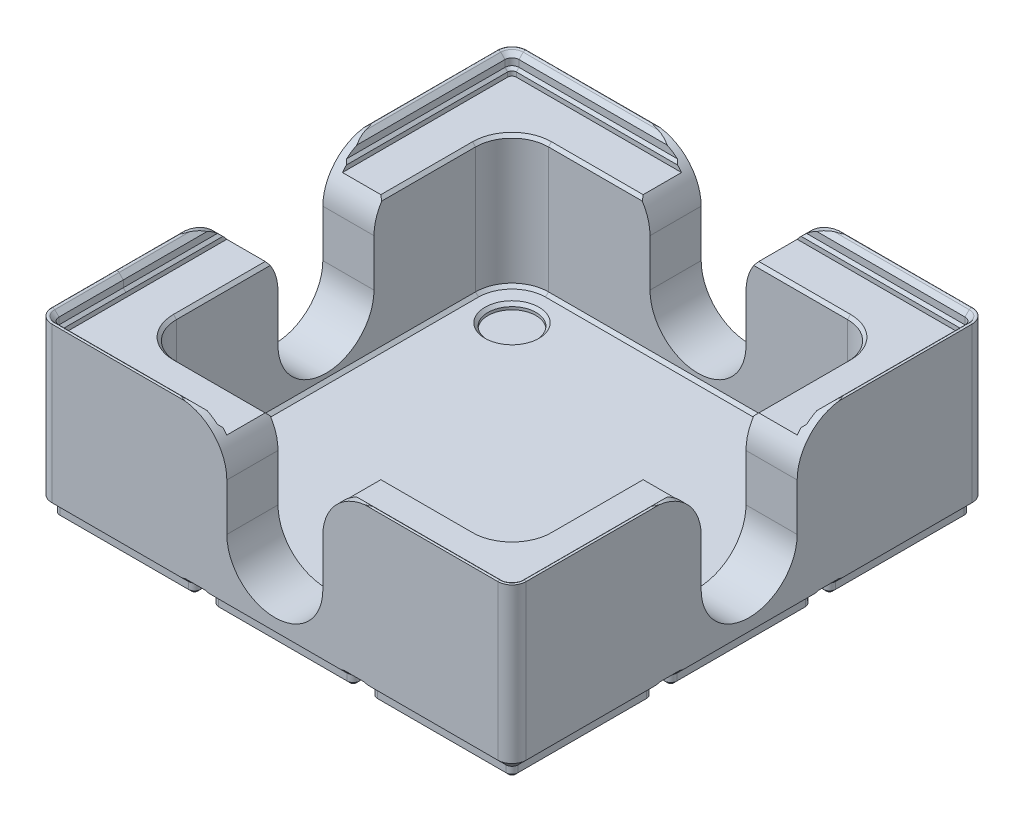
from build123d import *

# Parameters (mm, degrees)
BASE_DEPTH                          = 5
BOX_START                           = -126
BOX_OUTLINE_W                       = 126
BOX_OUTLINE_H                       = 37
BOX_DEPTH                           = 126
CORNER_FILLET_R                     = 4
BASE_CHAMFER_1_SIZE                 = 2.4
BASE_CHAMFER_2_SIZE                 = 0.8
BASE_PATTERN_COUNT                  = 3
BASE_PATTERN_PITCH                  = 42
BASE_PATTERN_COUNT_DIR2             = 3
BASE_PATTERN_PITCH_DIR2             = 42
BASE_CHAMFER_1_OF_BASE_PATTERN_SIZE = 2.4
BASE_CHAMFER_2_OF_BASE_PATTERN_SIZE = 0.8
MAGNET_START                        = -5
MAGNET_HOLE_OUTLINE_R               = 3.25
MAGNET_HOLE_DEPTH                   = 2
MAGNET_PATTERN_COUNT                = 3
MAGNET_PATTERN_PITCH                = 42
MAGNET_PATTERN_COUNT_DIR2           = 3
MAGNET_PATTERN_PITCH_DIR2           = 42
INTERIOR_CUT_DEPTH                  = 34.8
TOP_EDGE_FILLET_R                   = 0.6
NESTING_CLEARANCE_CUT_DEPTH         = 184.982198584
BOSS_EXTRUDE1_START                 = 33.6
BOSS_EXTRUDE1_DEPTH                 = 33.6
CUT_EXTRUDE1_DEPTH                  = 34.8
SKETCH18_R                          = 6.35
CUT_EXTRUDE2_DEPTH                  = 1.524
CUT_EXTRUDE3_REACH                  = 184.285
CIRPATTERN2_COUNT                   = 4
CHAMFER1_SIZE                       = 0.79375


# Read off the part's stored shape, not the designer's step: Box, Magnet Hole
with BuildPart() as part:
    # Master → Base (new body)
    with BuildSketch(Plane(origin=(0, 0, 0), x_dir=(1, 0, 0), z_dir=(0, 1, 0))):
        with BuildLine():
            Line((4, 2.4), (38, 2.4))
            ThreePointArc((38, 2.4), (39.13137085, 2.86862915), (39.6, 4))
            Line((39.6, 4), (39.6, 38))
            ThreePointArc((39.6, 38), (39.13137085, 39.13137085), (38, 39.6))
            Line((38, 39.6), (4, 39.6))
            ThreePointArc((4, 39.6), (2.86862915, 39.13137085), (2.4, 38))
            Line((2.4, 38), (2.4, 4))
            ThreePointArc((2.4, 4), (2.86862915, 2.86862915), (4, 2.4))
        make_face()
    base = extrude(amount=-BASE_DEPTH)

    # Box outline → Box (add)
    with BuildSketch(Plane.XY.offset(BOX_START)):
        with Locations((63, 18.5)):
            Rectangle(BOX_OUTLINE_W, BOX_OUTLINE_H)
    extrude(amount=BOX_DEPTH)

    # Corner Fillet
    corner_fillet_edges = [part.edges().sort_by_distance(p)[0] for p in [
        (0, 18.5, 0),
        (126, 18.5, 0),
        (126, 18.5, -126),
        (0, 18.5, -126),
    ]]
    fillet(corner_fillet_edges, radius=CORNER_FILLET_R)

    # Base Chamfer 1
    base_chamfer_1_edges = [part.edges().sort_by_distance(p)[0] for p in [
        (21, 0, -39.6),
        (2.86862915, 0, -39.13137085),
        (2.4, 0, -21),
        (2.86862915, 0, -2.86862915),
        (21, 0, -2.4),
        (39.13137085, 0, -2.86862915),
        (39.6, 0, -21),
        (39.13137085, 0, -39.13137085),
    ]]
    chamfer(base_chamfer_1_edges, length=BASE_CHAMFER_1_SIZE - 0.0001)  # a hair under: the kernel refuses the full size

    # Base Chamfer 2
    base_chamfer_2_edges = [part.edges().sort_by_distance(p)[0] for p in [
        (2.86862915, -5, -39.13137085),
        (21, -5, -39.6),
        (39.13137085, -5, -39.13137085),
        (39.6, -5, -21),
        (39.13137085, -5, -2.86862915),
        (21, -5, -2.4),
        (2.86862915, -5, -2.86862915),
        (2.4, -5, -21),
    ]]
    chamfer(base_chamfer_2_edges, length=BASE_CHAMFER_2_SIZE)

    # Base Pattern: Base 3 × 3
    with Locations(*[(j * BASE_PATTERN_PITCH_DIR2, 0, -i * BASE_PATTERN_PITCH) for i in range(BASE_PATTERN_COUNT) for j in range(BASE_PATTERN_COUNT_DIR2) if (i, j) != (0, 0)]):
        add(base)

    # Base Chamfer 1 of Base Pattern
    base_chamfer_1_of_base_pattern_edges = [part.edges().sort_by_distance(p)[0] for p in [
        (63, 0, -39.6),
        (44.86862915, 0, -39.13137085),
        (44.4, 0, -21),
        (44.86862915, 0, -2.86862915),
        (63, 0, -2.4),
        (81.13137085, 0, -2.86862915),
        (81.6, 0, -21),
        (81.13137085, 0, -39.13137085),
        (105, 0, -39.6),
        (86.86862915, 0, -39.13137085),
        (86.4, 0, -21),
        (86.86862915, 0, -2.86862915),
        (105, 0, -2.4),
        (123.13137085, 0, -2.86862915),
        (123.6, 0, -21),
        (123.13137085, 0, -39.13137085),
        (21, 0, -81.6),
        (2.86862915, 0, -81.13137085),
        (2.4, 0, -63),
        (2.86862915, 0, -44.86862915),
        (21, 0, -44.4),
        (39.13137085, 0, -44.86862915),
        (39.6, 0, -63),
        (39.13137085, 0, -81.13137085),
        (63, 0, -81.6),
        (44.86862915, 0, -81.13137085),
        (44.4, 0, -63),
        (44.86862915, 0, -44.86862915),
        (63, 0, -44.4),
        (81.13137085, 0, -44.86862915),
        (81.6, 0, -63),
        (81.13137085, 0, -81.13137085),
        (105, 0, -81.6),
        (86.86862915, 0, -81.13137085),
        (86.4, 0, -63),
        (86.86862915, 0, -44.86862915),
        (105, 0, -44.4),
        (123.13137085, 0, -44.86862915),
        (123.6, 0, -63),
        (123.13137085, 0, -81.13137085),
        (21, 0, -123.6),
        (2.86862915, 0, -123.13137085),
        (2.4, 0, -105),
        (2.86862915, 0, -86.86862915),
        (21, 0, -86.4),
        (39.13137085, 0, -86.86862915),
        (39.6, 0, -105),
        (39.13137085, 0, -123.13137085),
        (63, 0, -123.6),
        (44.86862915, 0, -123.13137085),
        (44.4, 0, -105),
        (44.86862915, 0, -86.86862915),
        (63, 0, -86.4),
        (81.13137085, 0, -86.86862915),
        (81.6, 0, -105),
        (81.13137085, 0, -123.13137085),
        (105, 0, -123.6),
        (86.86862915, 0, -123.13137085),
        (86.4, 0, -105),
        (86.86862915, 0, -86.86862915),
        (105, 0, -86.4),
        (123.13137085, 0, -86.86862915),
        (123.6, 0, -105),
        (123.13137085, 0, -123.13137085),
    ]]
    chamfer(base_chamfer_1_of_base_pattern_edges, length=BASE_CHAMFER_1_OF_BASE_PATTERN_SIZE - 0.0001)  # a hair under: the kernel refuses the full size

    # Base Chamfer 2 of Base Pattern
    base_chamfer_2_of_base_pattern_edges = [part.edges().sort_by_distance(p)[0] for p in [
        (44.86862915, -5, -39.13137085),
        (63, -5, -39.6),
        (81.13137085, -5, -39.13137085),
        (81.6, -5, -21),
        (81.13137085, -5, -2.86862915),
        (63, -5, -2.4),
        (44.86862915, -5, -2.86862915),
        (44.4, -5, -21),
        (86.86862915, -5, -39.13137085),
        (105, -5, -39.6),
        (123.13137085, -5, -39.13137085),
        (123.6, -5, -21),
        (123.13137085, -5, -2.86862915),
        (105, -5, -2.4),
        (86.86862915, -5, -2.86862915),
        (86.4, -5, -21),
        (2.86862915, -5, -81.13137085),
        (21, -5, -81.6),
        (39.13137085, -5, -81.13137085),
        (39.6, -5, -63),
        (39.13137085, -5, -44.86862915),
        (21, -5, -44.4),
        (2.86862915, -5, -44.86862915),
        (2.4, -5, -63),
        (44.86862915, -5, -81.13137085),
        (63, -5, -81.6),
        (81.13137085, -5, -81.13137085),
        (81.6, -5, -63),
        (81.13137085, -5, -44.86862915),
        (63, -5, -44.4),
        (44.86862915, -5, -44.86862915),
        (44.4, -5, -63),
        (86.86862915, -5, -81.13137085),
        (105, -5, -81.6),
        (123.13137085, -5, -81.13137085),
        (123.6, -5, -63),
        (123.13137085, -5, -44.86862915),
        (105, -5, -44.4),
        (86.86862915, -5, -44.86862915),
        (86.4, -5, -63),
        (2.86862915, -5, -123.13137085),
        (21, -5, -123.6),
        (39.13137085, -5, -123.13137085),
        (39.6, -5, -105),
        (39.13137085, -5, -86.86862915),
        (21, -5, -86.4),
        (2.86862915, -5, -86.86862915),
        (2.4, -5, -105),
        (44.86862915, -5, -123.13137085),
        (63, -5, -123.6),
        (81.13137085, -5, -123.13137085),
        (81.6, -5, -105),
        (81.13137085, -5, -86.86862915),
        (63, -5, -86.4),
        (44.86862915, -5, -86.86862915),
        (44.4, -5, -105),
        (86.86862915, -5, -123.13137085),
        (105, -5, -123.6),
        (123.13137085, -5, -123.13137085),
        (123.6, -5, -105),
        (123.13137085, -5, -86.86862915),
        (105, -5, -86.4),
        (86.86862915, -5, -86.86862915),
        (86.4, -5, -105),
    ]]
    chamfer(base_chamfer_2_of_base_pattern_edges, length=BASE_CHAMFER_2_OF_BASE_PATTERN_SIZE)

    # Magnet Hole outline → Magnet Hole (cut)
    with BuildSketch(Plane(origin=(0, 0, 0), x_dir=(1, 0, 0), z_dir=(0, 1, 0)).offset(MAGNET_START)):
        with Locations((8, 8)):
            Circle(MAGNET_HOLE_OUTLINE_R)
        with Locations((34, 8)):
            Circle(MAGNET_HOLE_OUTLINE_R)
        with Locations((34, 34)):
            Circle(MAGNET_HOLE_OUTLINE_R)
        with Locations((8, 34)):
            Circle(MAGNET_HOLE_OUTLINE_R)
    magnet_hole = extrude(amount=MAGNET_HOLE_DEPTH, mode=Mode.SUBTRACT)

    # Magnet Pattern: Magnet Hole 3 × 3
    with Locations(*[(i * MAGNET_PATTERN_PITCH, 0, -j * MAGNET_PATTERN_PITCH_DIR2) for i in range(MAGNET_PATTERN_COUNT) for j in range(MAGNET_PATTERN_COUNT_DIR2) if (i, j) != (0, 0)]):
        add(magnet_hole, mode=Mode.SUBTRACT)

    # Top Nesting Feature: sweep along a path in Sketch5
    with BuildLine(Plane(origin=(0, 37, 0), x_dir=(1, 0, 0), z_dir=(0, 1, 0))) as top_nesting_feature_path:
        Line((4, 0), (122, 0))
        ThreePointArc((122, 0), (124.828427125, 1.171572875), (126, 4))
        Line((126, 4), (126, 122))
        ThreePointArc((126, 122), (124.828427125, 124.828427125), (122, 126))
        Line((122, 126), (4, 126))
        ThreePointArc((4, 126), (1.171572875, 124.828427125), (0, 122))
        Line((0, 122), (0, 4))
        ThreePointArc((0, 4), (1.171572875, 1.171572875), (4, 0))
    # Sketch4 → Top Nesting Feature (sweep)
    with BuildSketch(Plane(origin=(0, 0, -21), x_dir=(-1, 0, 0), z_dir=(0, 0, -1))):
        Polygon((0, 37), (0, 41.646446609), (-2.15, 39.496446609), (-2.15, 37.696446609), (-2.846446609, 37), align=None)
    sweep(path=top_nesting_feature_path.line)

    # Sketch6 → Interior Cut (cut)
    with BuildSketch(Plane(origin=(0, 37, 0), x_dir=(1, 0, 0), z_dir=(0, 1, 0))):
        with BuildLine():
            Line((2.846446609, 122), (2.846446609, 21))
            Line((2.846446609, 21), (2.846446609, 4))
            ThreePointArc((2.846446609, 4), (3.184314575, 3.184314575), (4, 2.846446609))
            Line((4, 2.846446609), (122, 2.846446609))
            ThreePointArc((122, 2.846446609), (122.815685425, 3.184314575), (123.153553391, 4))
            Line((123.153553391, 4), (123.153553391, 122))
            ThreePointArc((123.153553391, 122), (122.815685425, 122.815685425), (122, 123.153553391))
            Line((122, 123.153553391), (4, 123.153553391))
            ThreePointArc((4, 123.153553391), (3.184314575, 122.815685425), (2.846446609, 122))
        make_face()
    extrude(amount=-INTERIOR_CUT_DEPTH, mode=Mode.SUBTRACT)

    # Interior Sweep: sweep along a path in Sketch7
    with BuildLine(Plane(origin=(0, 2.2, 0), x_dir=(1, 0, 0), z_dir=(0, 1, 0))) as interior_sweep_path:
        Line((4, 1.2), (122, 1.2))
        ThreePointArc((122, 1.2), (123.979898987, 2.020101013), (124.8, 4))
        Line((124.8, 4), (124.8, 122))
        ThreePointArc((124.8, 122), (123.979898987, 123.979898987), (122, 124.8))
        Line((122, 124.8), (4, 124.8))
        ThreePointArc((4, 124.8), (2.020101013, 123.979898987), (1.2, 122))
        Line((1.2, 122), (1.2, 4))
        ThreePointArc((1.2, 4), (2.020101013, 2.020101013), (4, 1.2))
    # Sketch8 → Interior Sweep (sweep, cut)
    with BuildSketch(Plane(origin=(0, 0, -21), x_dir=(-1, 0, 0), z_dir=(0, 0, -1))):
        Polygon((-2.846446609, 35.8), (-1.45, 34.403553391), (-1.45, 2.2), (-2.846446609, 2.2), align=None)
    sweep(path=interior_sweep_path.line, mode=Mode.SUBTRACT)

    # Top Edge Fillet
    top_edge_fillet_edges = [part.edges().sort_by_distance(p)[0] for p in [
        (0, 41.646446609, -63),
        (1.171572875, 41.646446609, -1.171572875),
        (63, 41.646446609, 0),
        (124.828427125, 41.646446609, -1.171572875),
        (126, 41.646446609, -63),
        (124.828427125, 41.646446609, -124.828427125),
        (63, 41.646446609, -126),
        (1.171572875, 41.646446609, -124.828427125),
        (0, 41.646446609, -63),
    ]]
    fillet(top_edge_fillet_edges, radius=TOP_EDGE_FILLET_R)

    # Sketch14 → Nesting Clearance Cut (cut, through all)
    with BuildSketch(Plane.XZ.offset(5)):
        with BuildLine():
            Line((-1, -4), (-1, -122))
            ThreePointArc((-1, -122), (0.464466094, -125.535533906), (4, -127))
            Line((4, -127), (122, -127))
            ThreePointArc((122, -127), (125.535533906, -125.535533906), (127, -122))
            Line((127, -122), (127, -4))
            ThreePointArc((127, -4), (125.535533906, -0.464466094), (122, 1))
            Line((122, 1), (4, 1))
            ThreePointArc((4, 1), (0.464466094, -0.464466094), (-1, -4))
        make_face()
        with BuildLine():
            Line((0.25, -4), (0.25, -122))
            ThreePointArc((0.25, -122), (1.348349571, -124.651650429), (4, -125.75))
            Line((4, -125.75), (122, -125.75))
            ThreePointArc((122, -125.75), (124.651650429, -124.651650429), (125.75, -122))
            Line((125.75, -122), (125.75, -4))
            ThreePointArc((125.75, -4), (124.651650429, -1.348349571), (122, -0.25))
            Line((122, -0.25), (4, -0.25))
            ThreePointArc((4, -0.25), (1.348349571, -1.348349571), (0.25, -4))
        make_face(mode=Mode.SUBTRACT)
    extrude(amount=-NESTING_CLEARANCE_CUT_DEPTH, mode=Mode.SUBTRACT)

    # Sketch15 → Boss-Extrude1 (add)
    with BuildSketch(Plane(origin=(0, 2.2, 0), x_dir=(1, 0, 0), z_dir=(0, 1, 0)).offset(BOSS_EXTRUDE1_START)):
        with BuildLine():
            Line((1.45, 21), (1.45, 4))
            ThreePointArc((1.45, 4), (2.196877708, 2.196877708), (4, 1.45))
            Line((4, 1.45), (122, 1.45))
            ThreePointArc((122, 1.45), (123.803122292, 2.196877708), (124.55, 4))
            Line((124.55, 4), (124.55, 122))
            ThreePointArc((124.55, 122), (123.803122292, 123.803122292), (122, 124.55))
            Line((122, 124.55), (4, 124.55))
            ThreePointArc((4, 124.55), (2.196877708, 123.803122292), (1.45, 122))
            Line((1.45, 122), (1.45, 21))
        make_face()
    extrude(amount=-BOSS_EXTRUDE1_DEPTH)

    # Sketch16 → Cut-Extrude1 (cut)
    with BuildSketch(Plane(origin=(0, 35.8, 0), x_dir=(1, 0, 0), z_dir=(0, 1, 0))):
        with BuildLine():
            Line((23.4395, 13.7875), (102.5605, 13.7875))
            ThreePointArc((102.5605, 13.7875), (109.385494652, 16.614505348), (112.2125, 23.4395))
            Line((112.2125, 23.4395), (112.2125, 102.5605))
            ThreePointArc((112.2125, 102.5605), (109.385494652, 109.385494652), (102.5605, 112.2125))
            Line((102.5605, 112.2125), (23.4395, 112.2125))
            ThreePointArc((23.4395, 112.2125), (16.614505348, 109.385494652), (13.7875, 102.5605))
            Line((13.7875, 102.5605), (13.7875, 23.4395))
            ThreePointArc((13.7875, 23.4395), (16.614505348, 16.614505348), (23.4395, 13.7875))
        make_face()
    extrude(amount=-CUT_EXTRUDE1_DEPTH, mode=Mode.SUBTRACT)

    # Sketch18 → Cut-Extrude2 (cut)
    with BuildSketch(Plane(origin=(0, 1, 0), x_dir=(1, 0, 0), z_dir=(0, 1, 0))):
        with Locations(Location((24.9, 101.1, 0), (0, 0, 270))):
            Circle(SKETCH18_R)
        with Locations(Location((101.1, 101.1, 0), (0, 0, 270))):
            Circle(SKETCH18_R)
        with Locations(Location((101.1, 24.9, 0), (0, 0, 270))):
            Circle(SKETCH18_R)
        with Locations(Location((24.9, 24.9, 0), (0, 0, 270))):
            Circle(SKETCH18_R)
    extrude(amount=-CUT_EXTRUDE2_DEPTH, mode=Mode.SUBTRACT)

    # Cut-Extrude3: up to this face of the body (flat: up to its plane)
    cut_extrude3_end = Plane(part.part.faces().sort_by_distance((63, 18.4, -13.7875))[0])
    # Sketch20 → Cut-Extrude3 (cut, up to the picked face)
    with BuildSketch(Plane.XY.offset(-0.25), mode=Mode.PRIVATE) as cut_extrude3_sk1:
        with BuildLine():
            Line((50.3, 28.097918472), (50.3, 15.625))
            ThreePointArc((50.3, 15.625), (63, 2.925), (75.7, 15.625))
            Line((75.7, 15.625), (75.7, 28.097918472))
            ThreePointArc((75.7, 28.097918472), (79.419743879, 37.078174593), (88.4, 40.797918472))
            Line((88.4, 40.797918472), (37.6, 40.797918472))
            ThreePointArc((37.6, 40.797918472), (46.580256121, 37.078174593), (50.3, 28.097918472))
        make_face()
    cut_extrude3_tool1 = split(extrude(cut_extrude3_sk1.sketch, amount=-CUT_EXTRUDE3_REACH, mode=Mode.PRIVATE), bisect_by=cut_extrude3_end, keep=Keep.BOTH, mode=Mode.PRIVATE)
    cut_extrude3 = cut_extrude3_tool1.solids().sort_by(Axis((63, 24.178618, -0.25), (0, 0, -1)))[0]
    add(cut_extrude3, mode=Mode.SUBTRACT)

    # CirPattern2: Cut-Extrude3 ×4 about axis
    cirpattern2_axis = Axis((63, 0, -63), (0, 1, 0))
    for i in range(1, CIRPATTERN2_COUNT):
        add(cut_extrude3.rotate(cirpattern2_axis, i * 360 / CIRPATTERN2_COUNT), mode=Mode.SUBTRACT)

    # Chamfer1
    chamfer1_edges = [part.edges().sort_by_distance(p)[0] for p in [
        (16.614505348, 35.8, -109.385494652),
        (13.7875, 35.8, -90.431291193),
        (16.614505348, 35.8, -16.614505348),
        (35.568708807, 35.8, -13.7875),
        (109.385494652, 35.8, -16.614505348),
        (112.2125, 35.8, -35.568708807),
        (109.385494652, 35.8, -109.385494652),
        (90.431291193, 35.8, -112.2125),
        (16.614505348, 1, -109.385494652),
        (63, 1, -112.2125),
        (109.385494652, 1, -109.385494652),
        (112.2125, 1, -63),
        (109.385494652, 1, -16.614505348),
        (63, 1, -13.7875),
        (16.614505348, 1, -16.614505348),
        (13.7875, 1, -63),
        (24.9, 1, -31.25),
        (101.1, 1, -31.25),
        (101.1, 1, -107.45),
        (24.9, 1, -107.45),
        (90.431291193, 35.8, -13.7875),
        (13.7875, 35.8, -35.568708807),
        (112.2125, 35.8, -90.431291193),
        (35.568708807, 35.8, -112.2125),
    ]]
    chamfer(chamfer1_edges, length=CHAMFER1_SIZE)


solid = part.part
